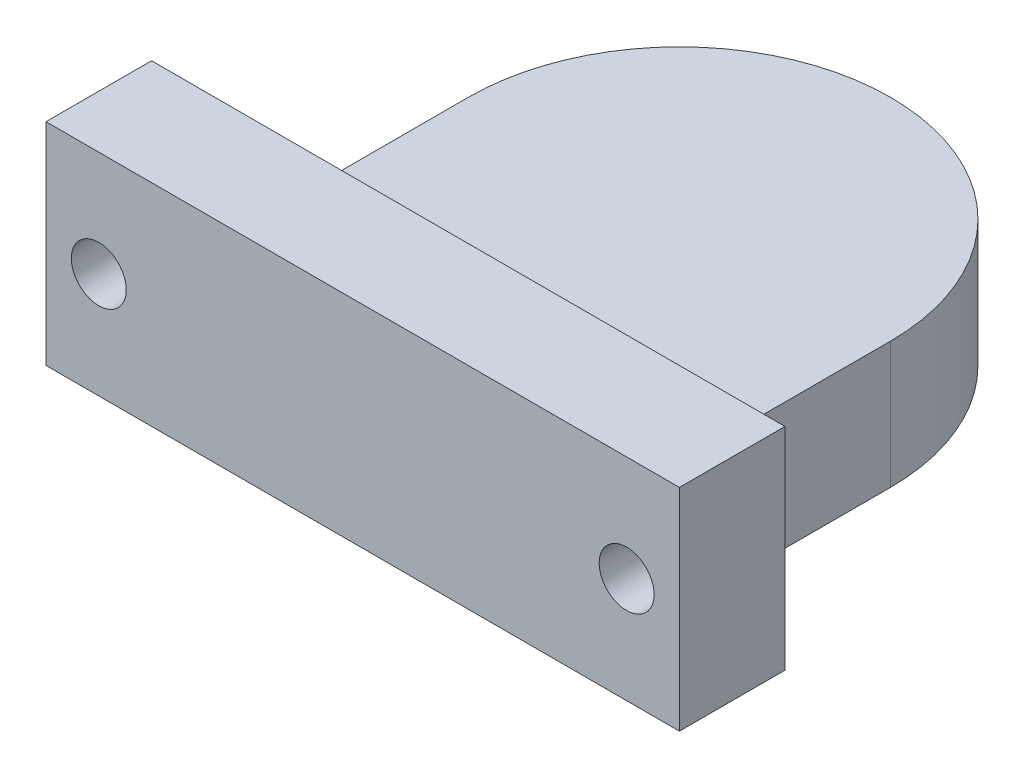
from build123d import *

# Parameters (mm, degrees)
SKETCH1_R           = 11.1
BOSS_EXTRUDE1_DEPTH = 12
BOSS_EXTRUDE2_START = -2
SKETCH3_R           = 11.1
BOSS_EXTRUDE2_DEPTH = 2
SKETCH4_W           = 60
SKETCH4_H           = 10
BOSS_EXTRUDE3_DEPTH = 20
SKETCH5_R           = 2.6
CUT_EXTRUDE1_DEPTH  = 54.851648071


with BuildPart() as part:
    # Sketch1 → Boss-Extrude1 (new body)
    with BuildSketch(Plane(origin=(0, 0, 0), x_dir=(1, 0, 0), z_dir=(0, 1, 0))):
        with BuildLine():
            Line((-20, 0), (-20, -20))
            Line((-20, -20), (20, -20))
            Line((20, -20), (20, 0))
            ThreePointArc((20, 0), (0, 20), (-20, 0))
        make_face()
        Circle(SKETCH1_R, mode=Mode.SUBTRACT)
    extrude(amount=BOSS_EXTRUDE1_DEPTH)

    # Sketch3 → Boss-Extrude2 (add)
    with BuildSketch(Plane(origin=(0, 12, 0), x_dir=(1, 0, 0), z_dir=(0, 1, 0)).offset(BOSS_EXTRUDE2_START)):
        Circle(SKETCH3_R)
    extrude(amount=BOSS_EXTRUDE2_DEPTH)

    # Sketch4 → Boss-Extrude3 (add)
    with BuildSketch(Plane(origin=(0, 0, 0), x_dir=(1, 0, 0), z_dir=(0, 1, 0))):
        with Locations((0, -25)):
            Rectangle(SKETCH4_W, SKETCH4_H)
    extrude(amount=BOSS_EXTRUDE3_DEPTH)

    # Sketch5 → Cut-Extrude1 (cut, through all)
    with BuildSketch(Plane(origin=(0, 0, 20), x_dir=(-1, 0, 0), z_dir=(0, 0, -1))):
        with Locations((25, 10)):
            Circle(SKETCH5_R)
        with Locations((-25, 10)):
            Circle(SKETCH5_R)
    extrude(amount=-CUT_EXTRUDE1_DEPTH, mode=Mode.SUBTRACT)


solid = part.part
